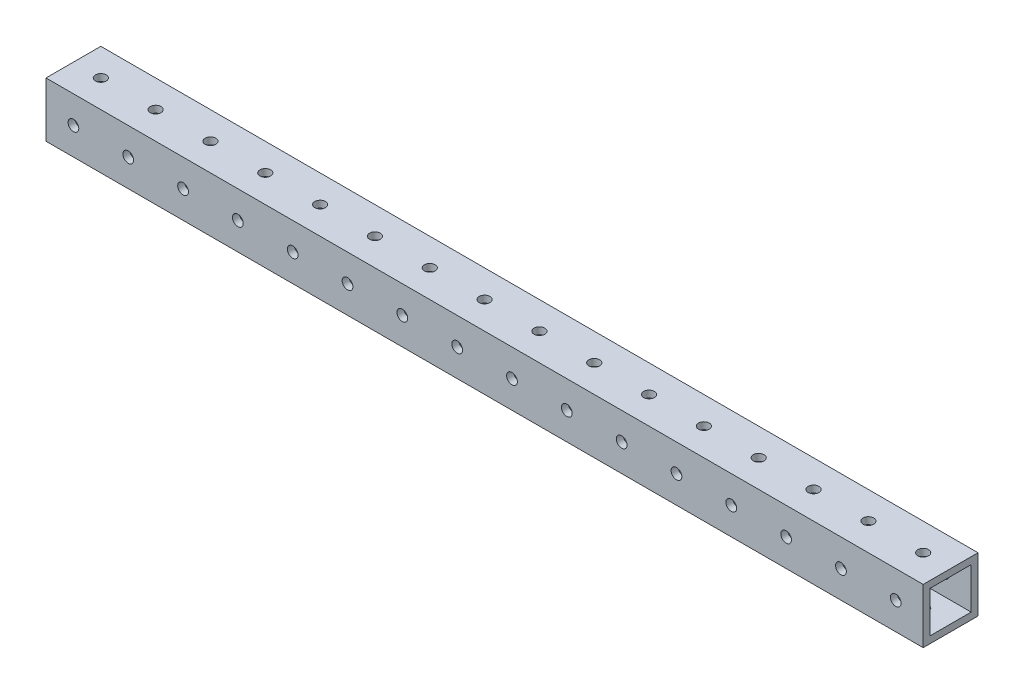
from build123d import *

# Parameters (mm, degrees)
SKETCH1_W             = 25.4
SKETCH1_H             = 25.4
SKETCH1_W_2           = 19.05
SKETCH1_H_2           = 19.05
BOSS_EXTRUDE1_DEPTH   = 203.2
SKETCH3_W             = 2.4892
SKETCH3_H             = 25.4
SKETCH3_AT_POINT_2_W  = 2.4892
SKETCH3_AT_POINT_2_H  = 25.4
LPATTERN1_START       = -12.7
LPATTERN1_OUTLINE_R   = 2.4892
LPATTERN1_DEPTH       = 25.4
LPATTERN1_2_OUTLINE_R = 2.4892
LPATTERN1_2_DEPTH     = 25.4


# Read off the part's stored shape, not the designer's step: LPattern1
with BuildPart() as part:
    # Sketch1 → Boss-Extrude1 (new, symmetric)
    with BuildSketch(Plane(origin=(0, 0, 0), x_dir=(0, 0, -1), z_dir=(1, 0, 0))):
        Rectangle(SKETCH1_W, SKETCH1_H)
        Rectangle(SKETCH1_W_2, SKETCH1_H_2, mode=Mode.SUBTRACT)
    extrude(amount=BOSS_EXTRUDE1_DEPTH, both=True)

    # Sketch3 → #9 (0.196) Diameter Hole1 (revolve, cut)
    with BuildSketch(Plane(origin=(190.5, 12.7, 0), x_dir=(0, 0, 1), z_dir=(1, 0, 0))):
        with Locations((1.2446, 12.7)):
            Rectangle(SKETCH3_W, SKETCH3_H)
    revolve(axis=Axis((190.5, 19.05, 0), (0, -1, 0)), mode=Mode.SUBTRACT)

    # Sketch3 at point 2 (carried to point 2, square into its face) → #9 (0.196) Diameter Hole1 at 2 (revolve, cut)
    with BuildSketch(Plane(origin=(190.5, 0, 12.7), x_dir=(0, -1, 0), z_dir=(1, 0, 0))):
        with Locations((1.2446, 12.7)):
            Rectangle(SKETCH3_AT_POINT_2_W, SKETCH3_AT_POINT_2_H)
    revolve(axis=Axis((190.5, 0, 19.05), (0, 0, -1)), mode=Mode.SUBTRACT)

    # LPattern1 outline → LPattern1 (cut)
    with BuildSketch(Plane.XY.offset(LPATTERN1_START)):
        with Locations((165.1, 0)):
            Circle(LPATTERN1_OUTLINE_R)
        with Locations((139.7, 0)):
            Circle(LPATTERN1_OUTLINE_R)
        with Locations((114.3, 0)):
            Circle(LPATTERN1_OUTLINE_R)
        with Locations((88.9, 0)):
            Circle(LPATTERN1_OUTLINE_R)
        with Locations((63.5, 0)):
            Circle(LPATTERN1_OUTLINE_R)
        with Locations((38.1, 0)):
            Circle(LPATTERN1_OUTLINE_R)
        with Locations((12.7, 0)):
            Circle(LPATTERN1_OUTLINE_R)
        with Locations((-12.7, 0)):
            Circle(LPATTERN1_OUTLINE_R)
        with Locations((-38.1, 0)):
            Circle(LPATTERN1_OUTLINE_R)
        with Locations((-63.5, 0)):
            Circle(LPATTERN1_OUTLINE_R)
        with Locations((-88.9, 0)):
            Circle(LPATTERN1_OUTLINE_R)
        with Locations((-114.3, 0)):
            Circle(LPATTERN1_OUTLINE_R)
        with Locations((-139.7, 0)):
            Circle(LPATTERN1_OUTLINE_R)
        with Locations((-165.1, 0)):
            Circle(LPATTERN1_OUTLINE_R)
        with Locations((-190.5, 0)):
            Circle(LPATTERN1_OUTLINE_R)
    extrude(amount=LPATTERN1_DEPTH, mode=Mode.SUBTRACT)

    # LPattern1 2 outline → LPattern1 2 (cut)
    with BuildSketch(Plane(origin=(0, 0, 0), x_dir=(1, 0, 0), z_dir=(0, 1, 0)).offset(LPATTERN1_START)):
        with Locations((165.1, 0)):
            Circle(LPATTERN1_2_OUTLINE_R)
        with Locations((139.7, 0)):
            Circle(LPATTERN1_2_OUTLINE_R)
        with Locations((114.3, 0)):
            Circle(LPATTERN1_2_OUTLINE_R)
        with Locations((88.9, 0)):
            Circle(LPATTERN1_2_OUTLINE_R)
        with Locations((63.5, 0)):
            Circle(LPATTERN1_2_OUTLINE_R)
        with Locations((38.1, 0)):
            Circle(LPATTERN1_2_OUTLINE_R)
        with Locations((12.7, 0)):
            Circle(LPATTERN1_2_OUTLINE_R)
        with Locations((-12.7, 0)):
            Circle(LPATTERN1_2_OUTLINE_R)
        with Locations((-38.1, 0)):
            Circle(LPATTERN1_2_OUTLINE_R)
        with Locations((-63.5, 0)):
            Circle(LPATTERN1_2_OUTLINE_R)
        with Locations((-88.9, 0)):
            Circle(LPATTERN1_2_OUTLINE_R)
        with Locations((-114.3, 0)):
            Circle(LPATTERN1_2_OUTLINE_R)
        with Locations((-139.7, 0)):
            Circle(LPATTERN1_2_OUTLINE_R)
        with Locations((-165.1, 0)):
            Circle(LPATTERN1_2_OUTLINE_R)
        with Locations((-190.5, 0)):
            Circle(LPATTERN1_2_OUTLINE_R)
    extrude(amount=LPATTERN1_2_DEPTH, mode=Mode.SUBTRACT)


solid = part.part
